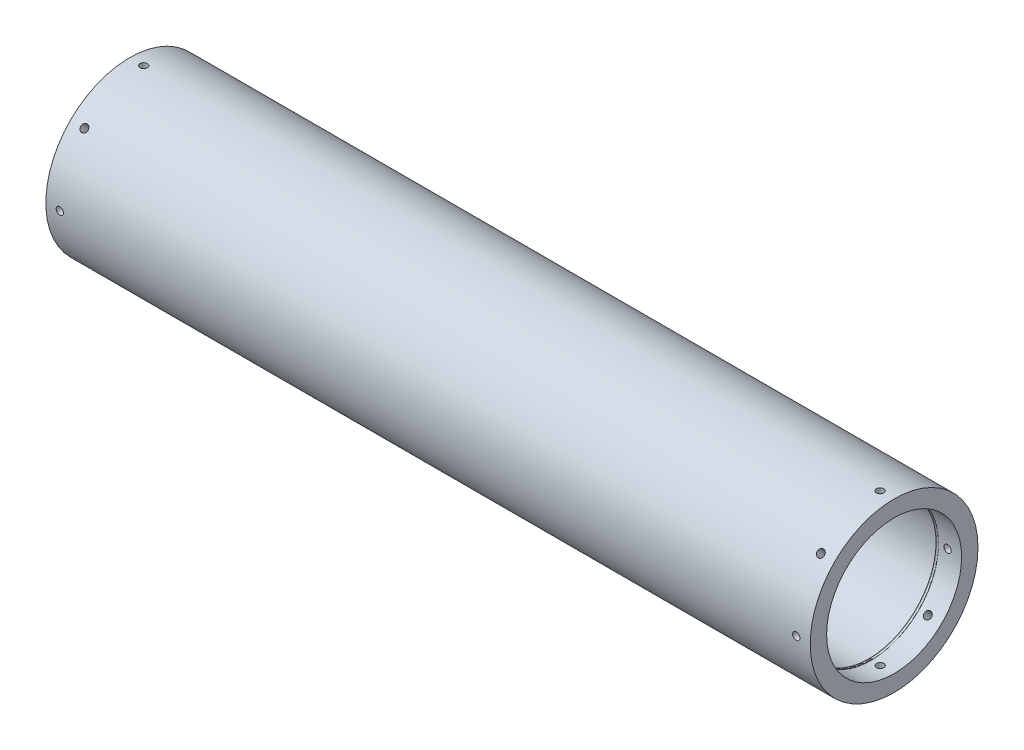
from build123d import *

# Parameters (mm, degrees)
SKETCH1_R           = 57.15
SKETCH1_R_2         = 45.974
BOSS_EXTRUDE1_DEPTH = 520.7
SKETCH2_R           = 53.975
SKETCH2_R_2         = 44.577
BOSS_EXTRUDE2_DEPTH = 95.25
SKETCH4_R           = 2.4892
CUT_EXTRUDE1_DEPTH  = 19.05
CIRPATTERN1_COUNT   = 8
SKETCH5_R           = 2.4892
CUT_EXTRUDE2_DEPTH  = 19.05
CIRPATTERN2_COUNT   = 8
SKETCH6_R           = 0.889


with BuildPart() as part:
    # Sketch1 → Boss-Extrude1 (new body)
    with BuildSketch(Plane(origin=(0, 0, 0), x_dir=(0, 0, -1), z_dir=(1, 0, 0))):
        Circle(SKETCH1_R)
        Circle(SKETCH1_R_2, mode=Mode.SUBTRACT)
    extrude(amount=BOSS_EXTRUDE1_DEPTH)

    # Sketch2 → Boss-Extrude2 (add)
    with BuildSketch(Plane.ZY):
        Circle(SKETCH2_R)
        Circle(SKETCH2_R_2, mode=Mode.SUBTRACT)
    extrude(amount=-BOSS_EXTRUDE2_DEPTH)

    # Sketch4 → Cut-Extrude1 (cut)
    with BuildSketch(Plane.XY.offset(57.15)):
        with Locations((9.525, 0)):
            Circle(SKETCH4_R)
    cut_extrude1 = extrude(amount=-CUT_EXTRUDE1_DEPTH, mode=Mode.SUBTRACT)

    # CirPattern1: Cut-Extrude1 ×8 about axis
    cirpattern1_axis = Axis((520.7, 0, 0), (-1, 0, 0))
    for i in range(1, CIRPATTERN1_COUNT):
        add(cut_extrude1.rotate(cirpattern1_axis, i * 360 / CIRPATTERN1_COUNT), mode=Mode.SUBTRACT)

    # Sketch5 → Cut-Extrude2 (cut)
    with BuildSketch(Plane.XY.offset(57.15)):
        with Locations((511.175, 0)):
            Circle(SKETCH5_R)
    cut_extrude2 = extrude(amount=-CUT_EXTRUDE2_DEPTH, mode=Mode.SUBTRACT)

    # CirPattern2: Cut-Extrude2 ×8 about axis
    cirpattern2_axis = Axis((520.7, 0, 0), (-1, 0, 0))
    for i in range(1, CIRPATTERN2_COUNT):
        add(cut_extrude2.rotate(cirpattern2_axis, i * 360 / CIRPATTERN2_COUNT), mode=Mode.SUBTRACT)

    # Sketch6 → Cut-Revolve2 (revolve, cut)
    with BuildSketch(Plane.XY):
        with Locations((504.19, 45.72)):
            Circle(SKETCH6_R)
    revolve(axis=Axis((0, 0, 0), (1, 0, 0)), mode=Mode.SUBTRACT)


solid = part.part
